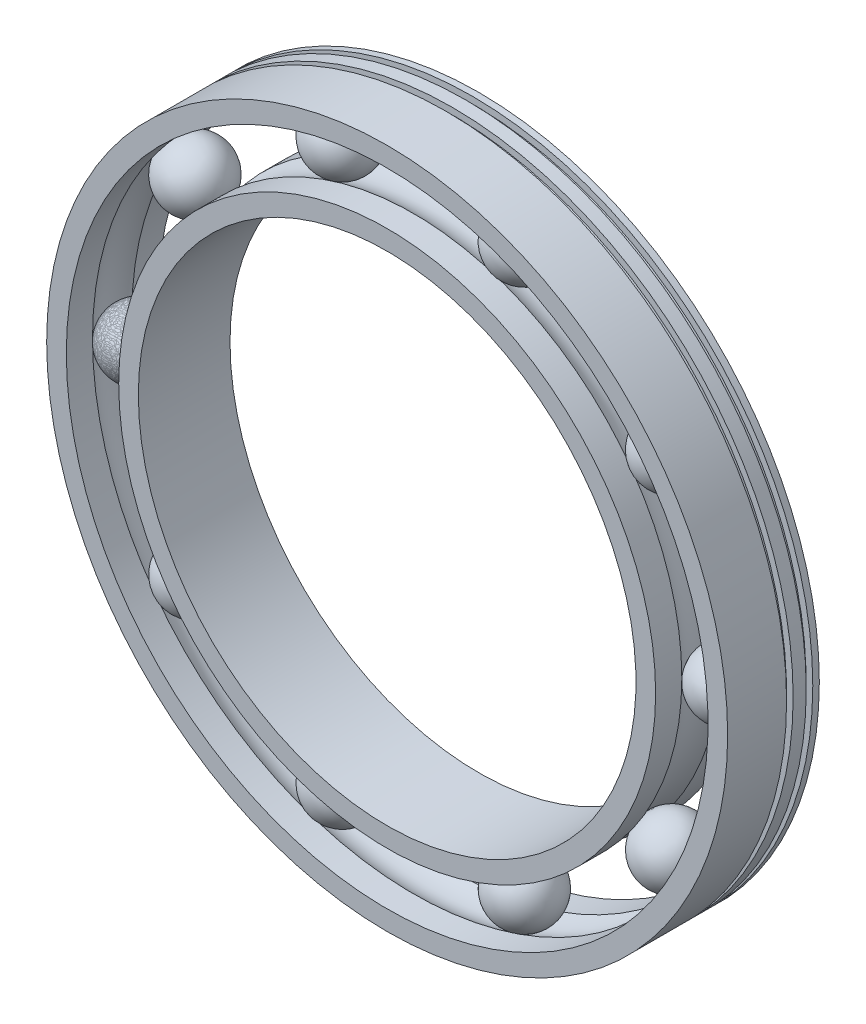
from build123d import *

# Parameters (mm, degrees)
CIRPATTERN1_COUNT   = 10
CIRPATTERN2_ANGLE   = 180
CIRPATTERN2_2_ANGLE = 180
CIRPATTERN2_3_ANGLE = 180
CIRPATTERN2_4_ANGLE = 180
CIRPATTERN2_5_ANGLE = 180
CIRPATTERN2_6_ANGLE = 180
CIRPATTERN2_7_ANGLE = 180
CIRPATTERN2_8_ANGLE = 180
CIRPATTERN2_9_ANGLE = 180


with BuildPart() as part:
    # Sketch2 → Revolve1 (revolve)
    with BuildSketch(Plane.XZ):
        with BuildLine():
            Line((-52.042412723, -7), (-49.042412723, -7))
            Line((-49.042412723, -7), (-49.042412723, -3))
            ThreePointArc((-49.042412723, -3), (-50.042412723, 0), (-49.042412723, 3))
            Line((-49.042412723, 3), (-49.042412723, 7))
            Line((-49.042412723, 7), (-52.042412723, 7))
            Line((-52.042412723, 7), (-52.042412723, -2))
            Line((-52.042412723, -2), (-51.042412723, -2))
            Line((-51.042412723, -2), (-51.042412723, -3))
            Line((-51.042412723, -3), (-52.042412723, -3))
            Line((-52.042412723, -3), (-52.042412723, -5))
            Line((-52.042412723, -5), (-51.026542885, -5))
            Line((-51.026542885, -5), (-51.026542885, -6))
            Line((-51.026542885, -6), (-52.042412723, -6))
            Line((-52.042412723, -6), (-52.042412723, -7))
        make_face()
        with BuildLine():
            Line((-38.042412723, -7), (-38.042412723, 7))
            Line((-38.042412723, 7), (-41.042412723, 7))
            Line((-41.042412723, 7), (-41.042412723, 3))
            ThreePointArc((-41.042412723, 3), (-40.042412723, 0), (-41.042412723, -3))
            Line((-41.042412723, -3), (-41.042412723, -7))
            Line((-41.042412723, -7), (-38.042412723, -7))
        make_face()
    revolve(axis=Axis((-0.042412723, 0, -20.515524483), (0, 0, 1)))


with BuildPart() as body_2:
    # Sketch3 → Revolve2 (revolve)
    with BuildSketch(Plane.XY):
        with BuildLine():
            Line((-45, 5), (-45, -5))
            ThreePointArc((-45, -5), (-40, 0), (-45, 5))
        make_face()
    revolve(axis=Axis((-45, 42.158378663, 0), (0, -1, 0)))


with BuildPart() as cirpattern1_1:
    # CirPattern1: pattern copy
    add(body_2.part.rotate(Axis((-19.44032735, 0, 0), (1, 0, 0)), 1 * 360 / CIRPATTERN1_COUNT))


with BuildPart() as cirpattern1_2:
    # CirPattern1: pattern copy
    add(body_2.part.rotate(Axis((-19.44032735, 0, 0), (1, 0, 0)), 2 * 360 / CIRPATTERN1_COUNT))


with BuildPart() as cirpattern1_3:
    # CirPattern1: pattern copy
    add(body_2.part.rotate(Axis((-19.44032735, 0, 0), (1, 0, 0)), 3 * 360 / CIRPATTERN1_COUNT))


with BuildPart() as cirpattern1_4:
    # CirPattern1: pattern copy
    add(body_2.part.rotate(Axis((-19.44032735, 0, 0), (1, 0, 0)), 4 * 360 / CIRPATTERN1_COUNT))


with BuildPart() as cirpattern1_5:
    # CirPattern1: pattern copy
    add(body_2.part.rotate(Axis((-19.44032735, 0, 0), (1, 0, 0)), 5 * 360 / CIRPATTERN1_COUNT))


with BuildPart() as cirpattern1_6:
    # CirPattern1: pattern copy
    add(body_2.part.rotate(Axis((-19.44032735, 0, 0), (1, 0, 0)), 6 * 360 / CIRPATTERN1_COUNT))


with BuildPart() as cirpattern1_7:
    # CirPattern1: pattern copy
    add(body_2.part.rotate(Axis((-19.44032735, 0, 0), (1, 0, 0)), 7 * 360 / CIRPATTERN1_COUNT))


with BuildPart() as cirpattern1_8:
    # CirPattern1: pattern copy
    add(body_2.part.rotate(Axis((-19.44032735, 0, 0), (1, 0, 0)), 8 * 360 / CIRPATTERN1_COUNT))


with BuildPart() as cirpattern1_9:
    # CirPattern1: pattern copy
    add(body_2.part.rotate(Axis((-19.44032735, 0, 0), (1, 0, 0)), 9 * 360 / CIRPATTERN1_COUNT))


with BuildPart() as body_12:
    # CirPattern2: read off the stored shape, not the designer's step
    # CirPattern2: copy of body 2
    add(body_2.part.rotate(Axis((0, 0, 0), (0.9510565163, 0.3090169944, 0)), CIRPATTERN2_ANGLE))


with BuildPart() as body_13:
    # CirPattern2 2: copy of body 2
    add(body_2.part.rotate(Axis((0, 0, 0), (0.8090169944, 0.5877852523, 0)), CIRPATTERN2_2_ANGLE))


with BuildPart() as body_14:
    # CirPattern2 3: copy of body 2
    add(body_2.part.rotate(Axis((0, 0, 0), (0.5877852523, 0.8090169944, 0)), CIRPATTERN2_3_ANGLE))


with BuildPart() as body_15:
    # CirPattern2 4: copy of body 2
    add(body_2.part.rotate(Axis((0, 0, 0), (0.3090169944, 0.9510565163, 0)), CIRPATTERN2_4_ANGLE))


with BuildPart() as body_16:
    # CirPattern2 5: copy of body 2
    add(body_2.part.rotate(Axis((0, 0, 0), (0, 1, 0)), CIRPATTERN2_5_ANGLE))


with BuildPart() as body_17:
    # CirPattern2 6: copy of body 2
    add(body_2.part.rotate(Axis((0, 0, 0), (0.3090169944, -0.9510565163, 0)), CIRPATTERN2_6_ANGLE))


with BuildPart() as body_18:
    # CirPattern2 7: copy of body 2
    add(body_2.part.rotate(Axis((0, 0, 0), (0.5877852523, -0.8090169944, 0)), CIRPATTERN2_7_ANGLE))


with BuildPart() as body_19:
    # CirPattern2 8: copy of body 2
    add(body_2.part.rotate(Axis((0, 0, 0), (0.8090169944, -0.5877852523, 0)), CIRPATTERN2_8_ANGLE))


with BuildPart() as body_20:
    # CirPattern2 9: copy of body 2
    add(body_2.part.rotate(Axis((0, 0, 0), (0.9510565163, -0.3090169944, 0)), CIRPATTERN2_9_ANGLE))


solid = Compound([part.part, body_2.part, cirpattern1_1.part, cirpattern1_2.part, cirpattern1_3.part, cirpattern1_4.part, cirpattern1_5.part, cirpattern1_6.part, cirpattern1_7.part, cirpattern1_8.part, cirpattern1_9.part, body_12.part, body_13.part, body_14.part, body_15.part, body_16.part, body_17.part, body_18.part, body_19.part, body_20.part])
